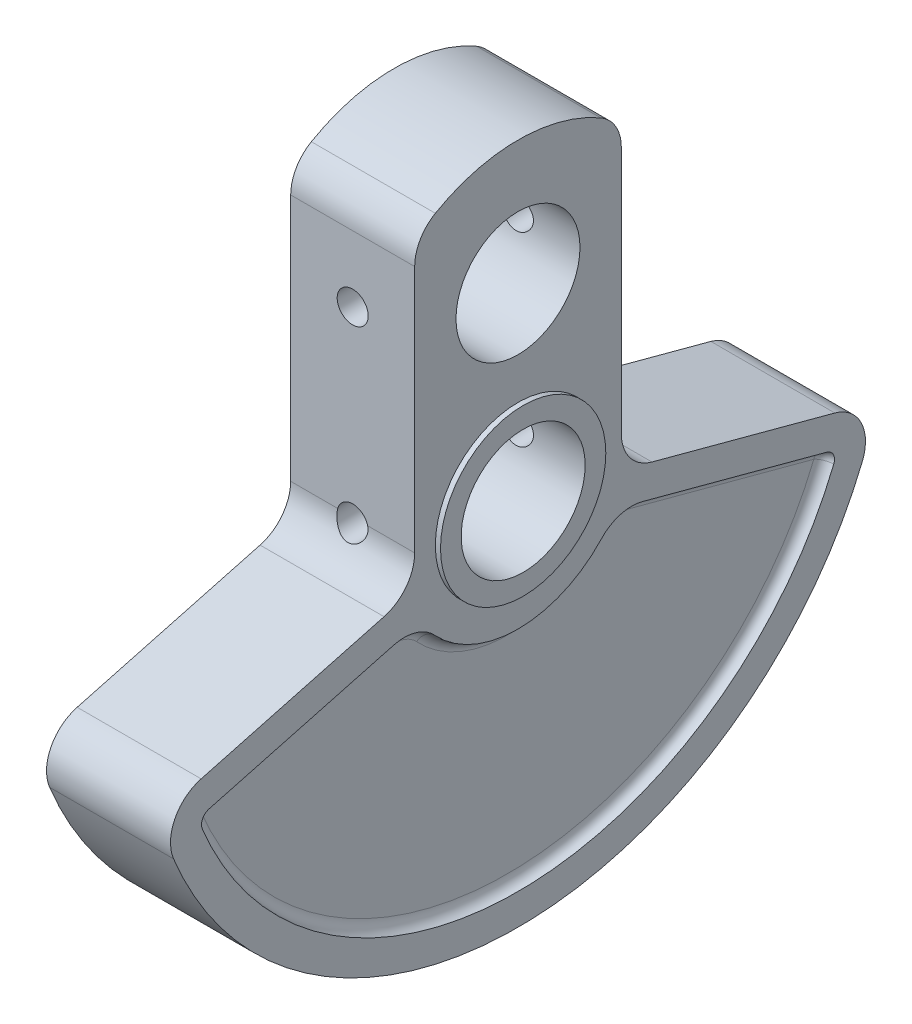
from build123d import *

# Parameters (mm, degrees)
SKETCH1_R               = 6
BOSS_EXTRUDE1_DEPTH     = 6
CUT_EXTRUDE1_DEPTH      = 1
FILLET1_R               = 1
FILLET1_OF_MIRROR1_R    = 1
SKETCH3_R               = 8
SKETCH3_R_2             = 6
BOSS_EXTRUDE2_DEPTH     = 0.5
SKETCH4_R               = 8
SKETCH4_R_2             = 6
BOSS_EXTRUDE3_DEPTH     = 0.5
CUT_EXTRUDE2_DEPTH      = 50.692614274
CUT_EXTRUDE2_DEPTH_BACK = 50.692614274
SKETCH5_R               = 1.5


with BuildPart() as part:
    # Sketch1 → Boss-Extrude1 (new, symmetric)
    with BuildSketch(Plane(origin=(0, 0, 0), x_dir=(0, 0, -1), z_dir=(1, 0, 0))):
        with BuildLine():
            Line((-12.96472382, -3.473887278), (-30.667194256, -8.217249935))
            ThreePointArc((-30.667194256, -8.217249935), (-33.214466382, -10.301810854), (-33.335907835, -13.591072395))
            ThreePointArc((-33.335907835, -13.591072395), (0, -36), (33.335907835, -13.591072395))
            ThreePointArc((33.335907835, -13.591072395), (33.214466382, -10.301810854), (30.667194256, -8.217249935))
            Line((30.667194256, -8.217249935), (12.96472382, -3.473887278))
            ThreePointArc((12.96472382, -3.473887278), (10.826586639, -2.045229688), (10, 0.389816028))
            Line((10, 0.389816028), (10, 24.392304845))
            ThreePointArc((10, 24.392304845), (9.464101615, 26.392304845), (8, 27.856406461))
            ThreePointArc((8, 27.856406461), (0, 30), (-8, 27.856406461))
            ThreePointArc((-8, 27.856406461), (-9.464101615, 26.392304845), (-10, 24.392304845))
            Line((-10, 24.392304845), (-10, 0.389816028))
            ThreePointArc((-10, 0.389816028), (-10.826586639, -2.045229688), (-12.96472382, -3.473887278))
        make_face()
        Circle(SKETCH1_R, mode=Mode.SUBTRACT)
        with Locations((0, 18)):
            Circle(SKETCH1_R, mode=Mode.SUBTRACT)
    extrude(amount=BOSS_EXTRUDE1_DEPTH, both=True)

    # Sketch2 → Cut-Extrude1 (cut, symmetric)
    with BuildSketch(Plane(origin=(6, 0, 0), x_dir=(0, 0, -1), z_dir=(1, 0, 0))):
        with BuildLine():
            ThreePointArc((-12.037997029, -6.331400124), (-9.894070596, -6.35181127), (-8.068661956, -7.476409181))
            ThreePointArc((-8.068661956, -7.476409181), (0, -11), (8.068661956, -7.476409181))
            ThreePointArc((8.068661956, -7.476409181), (9.894070596, -6.35181127), (12.037997029, -6.331400124))
            Line((12.037997029, -6.331400124), (12.188266684, -6.371664756))
            Line((12.188266684, -6.371664756), (29.89073712, -11.115027414))
            ThreePointArc((29.89073712, -11.115027414), (30.527555152, -11.636167644), (30.557915515, -12.458483029))
            ThreePointArc((30.557915515, -12.458483029), (0, -33), (-30.557915515, -12.458483029))
            ThreePointArc((-30.557915515, -12.458483029), (-30.527555152, -11.636167644), (-29.89073712, -11.115027414))
            Line((-29.89073712, -11.115027414), (-12.188266684, -6.371664756))
            Line((-12.188266684, -6.371664756), (-12.037997029, -6.331400124))
        make_face()
    cut_extrude1 = extrude(amount=CUT_EXTRUDE1_DEPTH, both=True, mode=Mode.SUBTRACT)

    # Fillet1
    fillet1_edges = [part.edges().sort_by_distance(p)[0] for p in [
        (5, -11, 0),
        (5, -6.35181127, -9.894070596),
        (5, -8.723213769, -20.964367075),
        (5, -11.636167644, -30.527555152),
        (5, -33, 0),
        (5, -11.636167644, 30.527555152),
        (5, -8.723213769, 20.964367075),
        (5, -6.35181127, 9.894070596),
    ]]
    fillet(fillet1_edges, radius=FILLET1_R - 0.0001)  # a hair under: the kernel refuses the full size

    # Mirror1: Cut-Extrude1 across plane
    add(cut_extrude1.mirror(Plane(origin=(0, 0, 0), x_dir=(0, 0, 1), z_dir=(1, 0, 0))), mode=Mode.SUBTRACT)

    # Fillet1 of Mirror1
    fillet1_of_mirror1_edges = [part.edges().sort_by_distance(p)[0] for p in [
        (-5, -11, 0),
        (-5, -6.35181127, -9.894070596),
        (-5, -8.723213769, -20.964367075),
        (-5, -11.636167644, -30.527555152),
        (-5, -33, 0),
        (-5, -11.636167644, 30.527555152),
        (-5, -8.723213769, 20.964367075),
        (-5, -6.35181127, 9.894070596),
    ]]
    fillet(fillet1_of_mirror1_edges, radius=FILLET1_OF_MIRROR1_R - 0.0001)  # a hair under: the kernel refuses the full size

    # Sketch3 → Boss-Extrude2 (add, symmetric)
    with BuildSketch(Plane(origin=(6, 0, 0), x_dir=(0, 0, -1), z_dir=(1, 0, 0))):
        with Locations(Location((0, 0, 0), (0, 0, 180))):
            Circle(SKETCH3_R)
        Circle(SKETCH3_R_2, mode=Mode.SUBTRACT)
    extrude(amount=BOSS_EXTRUDE2_DEPTH, both=True)

    # Sketch4 → Boss-Extrude3 (add, symmetric)
    with BuildSketch(Plane.ZY.offset(6)):
        with Locations((0, 18)):
            Circle(SKETCH4_R)
        with Locations((0, 18)):
            Circle(SKETCH4_R_2, mode=Mode.SUBTRACT)
    extrude(amount=BOSS_EXTRUDE3_DEPTH, both=True)

    # Sketch5 → Cut-Extrude2 (cut, two sides: drawn at the far end of the back side and taken through both)
    with BuildSketch(Plane.XY.offset(-CUT_EXTRUDE2_DEPTH_BACK)):
        with Locations((0, 18)):
            Circle(SKETCH5_R)
        Circle(SKETCH5_R)
    extrude(amount=CUT_EXTRUDE2_DEPTH + CUT_EXTRUDE2_DEPTH_BACK, mode=Mode.SUBTRACT)


solid = part.part
